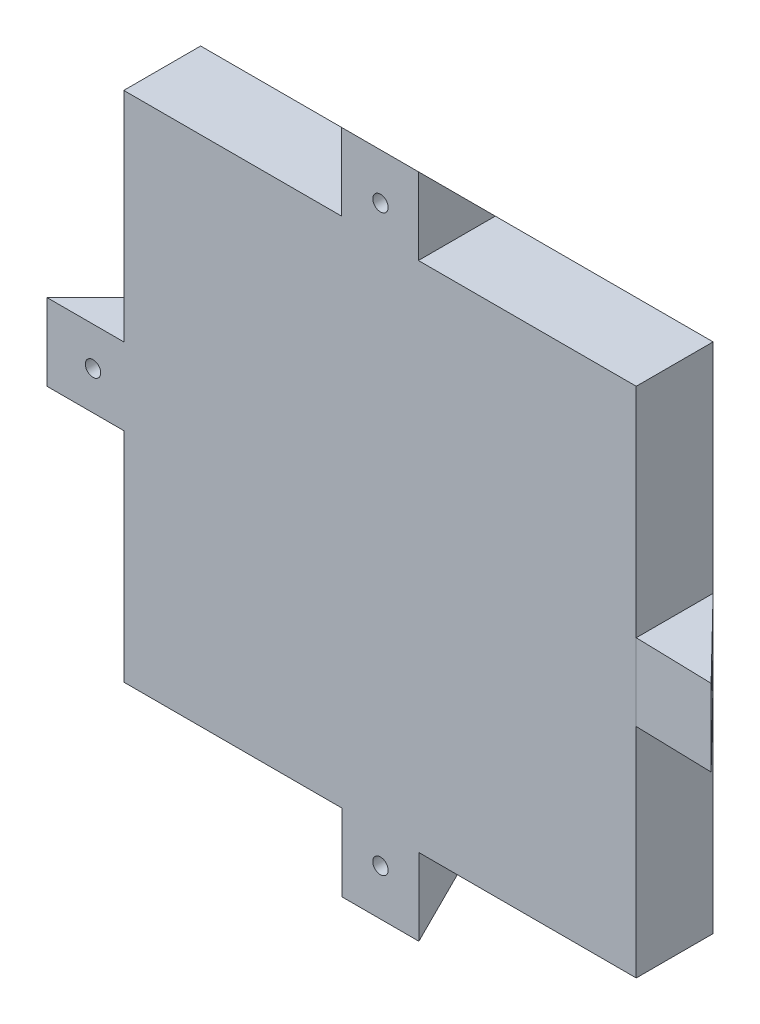
from build123d import *

# Parameters (mm, degrees)
BOSS_EXTRU_1_DEPTH      = 15
BOSS_EXTRU_2_START      = -7.5
BOSS_EXTRU_2_DEPTH      = 14.913164891
BOSS_EXTRU_2_START_2    = -7.586835109
BOSS_EXTRU_2_2_DEPTH    = 0.086835109
BOSS_EXTRU_2_START_3    = 7.413164891
BOSS_EXTRU_2_3_DEPTH    = 0.086835109
BOSS_EXTRU_3_DEPTH      = 7.5
BOSS_EXTRU_3_DEPTH_BACK = 7.5
ESQUISSE6_R             = 1.5
ENL_V_MAT_EXTRU_1_DEPTH = 15
ESQUISSE7_R             = 2.5
ENL_V_MAT_EXTRU_2_DEPTH = 7.5
ESQUISSE8_R             = 23.75
ESQUISSE8_R_2           = 14.05
ENL_V_MAT_EXTRU_3_DEPTH = 5.1
ENL_V_MAT_EXTRU_4_DEPTH = 9
ESQUISSE15_W            = 7.790942256
ESQUISSE15_H            = 7.790942256
ESQUISSE15_R            = 3
ENL_V_MAT_EXTRU_5_DEPTH = 2
ENL_V_MAT_EXTRU_6_DEPTH = 5
BOSS_EXTRU_6_START      = 4
ESQUISSE18_R            = 14.05
BOSS_EXTRU_6_DEPTH      = 4


# Read off the part's stored shape, not the designer's step: Boss.-Extru.2
with BuildPart() as part:
    # Esquisse1 → Boss.-Extru.1 (new body)
    with BuildSketch(Plane.XY):
        Polygon((49.913164891, 50), (-50.086835109, 50), (-50.086835109, 0), (-50.086835109, -50), (49.913164891, -50), (49.913164891, 0), align=None)
    extrude(amount=BOSS_EXTRU_1_DEPTH)

    # Boss.-Extru.2 outline → Boss.-Extru.2 (add)
    with BuildSketch(Plane.YZ.offset(BOSS_EXTRU_2_START)):
        Polygon((50, 0), (65, 15), (50, 15), align=None)
        Polygon((-50, 0), (-50, 15), (-65, 15), align=None)
    extrude(amount=BOSS_EXTRU_2_DEPTH)

    # Boss.-Extru.2 2 outline → Boss.-Extru.2 2 (add)
    with BuildSketch(Plane.YZ.offset(BOSS_EXTRU_2_START_2)):
        Polygon((50, 0), (65, 15), (50, 15), align=None)
    extrude(amount=BOSS_EXTRU_2_2_DEPTH)

    # Boss.-Extru.2 3 outline → Boss.-Extru.2 3 (add)
    with BuildSketch(Plane.YZ.offset(BOSS_EXTRU_2_START_3)):
        Polygon((-50, 0), (-50, 15), (-65, 15), align=None)
    extrude(amount=BOSS_EXTRU_2_3_DEPTH)

    # Esquisse4 → Boss.-Extru.3 (add, two sides: drawn at the far end of the back side and taken through both)
    with BuildSketch(Plane(origin=(0, 0, 0), x_dir=(1, 0, 0), z_dir=(0, 1, 0)).offset(-BOSS_EXTRU_3_DEPTH_BACK)):
        Polygon((-50.086835109, 0), (-50.086835109, -15), (-65.086835109, -15), align=None)
        Polygon((49.913164891, 0), (49.913164891, -15), (64.913164891, -15.393130345), align=None)
    extrude(amount=BOSS_EXTRU_3_DEPTH + BOSS_EXTRU_3_DEPTH_BACK)

    # Esquisse6 → Enlèv. mat.-Extru.1 (cut)
    with BuildSketch(Plane(origin=(0, 0, 0), x_dir=(-1, 0, 0), z_dir=(0, 0, -1))):
        with Locations((0, -56)):
            Circle(ESQUISSE6_R)
        with Locations((56.086835109, 0)):
            Circle(ESQUISSE6_R)
        with Locations((0, 56)):
            Circle(ESQUISSE6_R)
        with Locations((-55.913164891, 0)):
            Circle(ESQUISSE6_R)
    extrude(amount=-ENL_V_MAT_EXTRU_1_DEPTH, mode=Mode.SUBTRACT)

    # Esquisse7 → Enlèv. mat.-Extru.2 (cut)
    with BuildSketch(Plane(origin=(0, 0, 0), x_dir=(-1, 0, 0), z_dir=(0, 0, -1))):
        with Locations((56.086835109, 0)):
            Circle(ESQUISSE7_R)
        with Locations((0, 56)):
            Circle(ESQUISSE7_R)
        with Locations((-55.913164891, 0)):
            Circle(ESQUISSE7_R)
        with Locations((0, -56)):
            Circle(ESQUISSE7_R)
    extrude(amount=-ENL_V_MAT_EXTRU_2_DEPTH, mode=Mode.SUBTRACT)

    # Esquisse8 → Enlèv. mat.-Extru.3 (cut)
    with BuildSketch(Plane(origin=(0, 0, 0), x_dir=(-1, 0, 0), z_dir=(0, 0, -1))):
        Circle(ESQUISSE8_R)
        Circle(ESQUISSE8_R_2, mode=Mode.SUBTRACT)
    extrude(amount=-ENL_V_MAT_EXTRU_3_DEPTH, mode=Mode.SUBTRACT)

    # Esquisse11 → Enlèv. mat.-Extru.4 (cut)
    with BuildSketch(Plane(origin=(0, 0, 0), x_dir=(-1, 0, 0), z_dir=(0, 0, -1))):
        Polygon((23.724937024, -1.090808521), (23.708156389, 1.409191479), (31.708156389, 1.462889508), (31.724937024, -1.037110492), align=None)
        Polygon((-31.724937024, -1.037110492), (-31.708156389, 1.462889508), (-23.708156389, 1.409191479), (-23.724937024, -1.090808521), align=None)
    extrude(amount=-ENL_V_MAT_EXTRU_4_DEPTH, mode=Mode.SUBTRACT)

    # Esquisse15 → Enlèv. mat.-Extru.5 (cut)
    # profile 1 of 7: a face of its own
    with BuildSketch(Plane(origin=(0, 0, 0), x_dir=(-1, 0, 0), z_dir=(0, 0, -1))):
        Polygon((0, 5.509028101), (-1.495471128, 3.895471128), (1.495471128, 3.895471128), align=None)
    # profile 2 of 7: a face of its own
    with BuildSketch(Plane(origin=(0, 0, 0), x_dir=(-1, 0, 0), z_dir=(0, 0, -1))):
        Polygon((-3.895471128, -1.495471128), (-3.895471128, 1.495471128), (-5.509028101, 0), align=None)
    # profile 3 of 7: a face of its own
    with BuildSketch(Plane(origin=(0, 0, 0), x_dir=(-1, 0, 0), z_dir=(0, 0, -1))):
        Polygon((1.495471128, -3.895471128), (-1.495471128, -3.895471128), (0, -5.509028101), align=None)
    # profile 4 of 7: a face of its own
    with BuildSketch(Plane(origin=(0, 0, 0), x_dir=(-1, 0, 0), z_dir=(0, 0, -1))):
        Polygon((5.509028101, 0), (3.895471128, 1.495471128), (3.895471128, -1.495471128), align=None)
    # profile 5 of 7: a face of its own
    with BuildSketch(Plane(origin=(0, 0, 0), x_dir=(-1, 0, 0), z_dir=(0, 0, -1))):
        Rectangle(ESQUISSE15_W, ESQUISSE15_H)
        Circle(ESQUISSE15_R, mode=Mode.SUBTRACT)
    # profile 6 of 7: a face of its own
    with BuildSketch(Plane(origin=(0, 0, 0), x_dir=(-1, 0, 0), z_dir=(0, 0, -1))):
        with BuildLine():
            ThreePointArc((3, 0), (0.776457135, 2.897777479), (-2.598076211, 1.5))
            Line((-2.598076211, 1.5), (-2.598076211, -1.5))
            ThreePointArc((-2.598076211, -1.5), (0.776457135, -2.897777479), (3, 0))
        make_face()
    # profile 7 of 7: a face of its own
    with BuildSketch(Plane(origin=(0, 0, 0), x_dir=(-1, 0, 0), z_dir=(0, 0, -1))):
        with BuildLine():
            Line((-2.598076211, -1.5), (-2.598076211, 1.5))
            ThreePointArc((-2.598076211, 1.5), (-3, 0), (-2.598076211, -1.5))
        make_face()
    extrude(amount=-ENL_V_MAT_EXTRU_5_DEPTH, mode=Mode.SUBTRACT)

    # Esquisse17 → Enlèv. mat.-Extru.6 (cut)
    with BuildSketch(Plane(origin=(0, 0, 2), x_dir=(-1, 0, 0), z_dir=(0, 0, -1))):
        with BuildLine():
            ThreePointArc((3.15, 0), (1.220286151, 2.904031975), (-2.204540769, 2.25))
            Line((-2.204540769, 2.25), (-2.204540769, -2.25))
            ThreePointArc((-2.204540769, -2.25), (1.220286151, -2.904031975), (3.15, 0))
        make_face()
    extrude(amount=-ENL_V_MAT_EXTRU_6_DEPTH, mode=Mode.SUBTRACT)

    # Esquisse18 → Boss.-Extru.6 (add)
    with BuildSketch(Plane(origin=(0, 0, 0), x_dir=(-1, 0, 0), z_dir=(0, 0, -1)).offset(BOSS_EXTRU_6_START)):
        Circle(ESQUISSE18_R)
        Polygon((0, 5.509028101), (1.495471128, 3.895471128), (3.895471128, 3.895471128), (3.895471128, 1.495471128), (5.509028101, 0), (3.895471128, -1.495471128), (3.895471128, -3.895471128), (1.495471128, -3.895471128), (0, -5.509028101), (-1.495471128, -3.895471128), (-3.895471128, -3.895471128), (-3.895471128, -1.495471128), (-5.509028101, 0), (-3.895471128, 1.495471128), (-3.895471128, 3.895471128), (-1.495471128, 3.895471128), align=None, mode=Mode.SUBTRACT)
    extrude(amount=-BOSS_EXTRU_6_DEPTH)


solid = part.part
